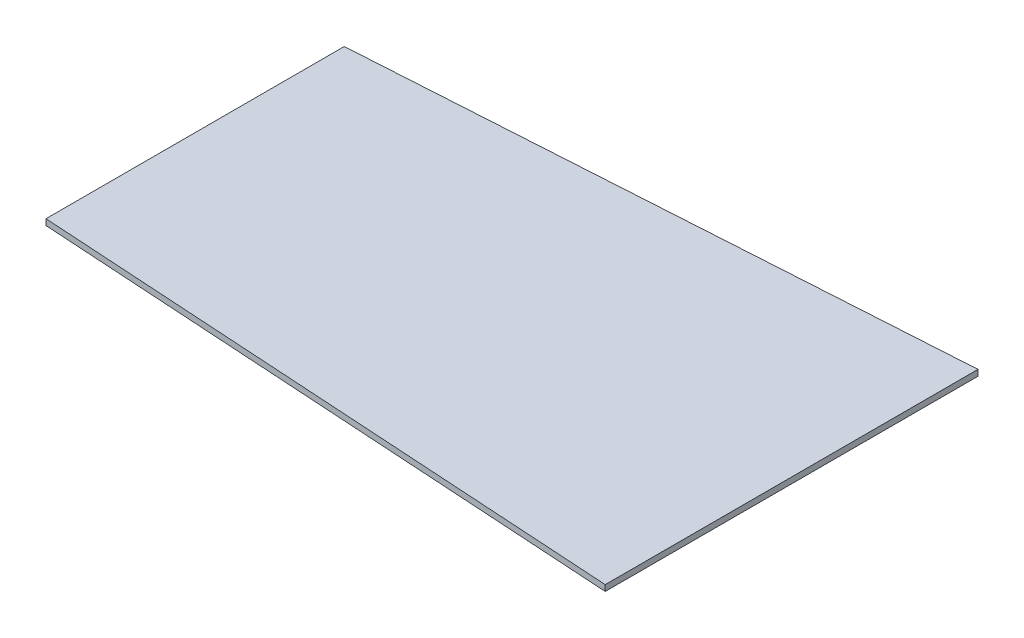
from build123d import *

# Parameters (mm, degrees)
BASE_FLANGE1_DEPTH = 0.508


# Sheet-metal steps are written as plain solids
with BuildPart() as part:
    # Sketch1 → Base-Flange1 (new body)
    with BuildSketch(Plane(origin=(0, 0, 0), x_dir=(1, 0, 0), z_dir=(0, 1, 0))):
        Polygon((-25.4, 12.7), (25.4, 15.875), (25.4, -15.875), (-25.4, -12.7), align=None)
    extrude(amount=-BASE_FLANGE1_DEPTH)


solid = part.part
